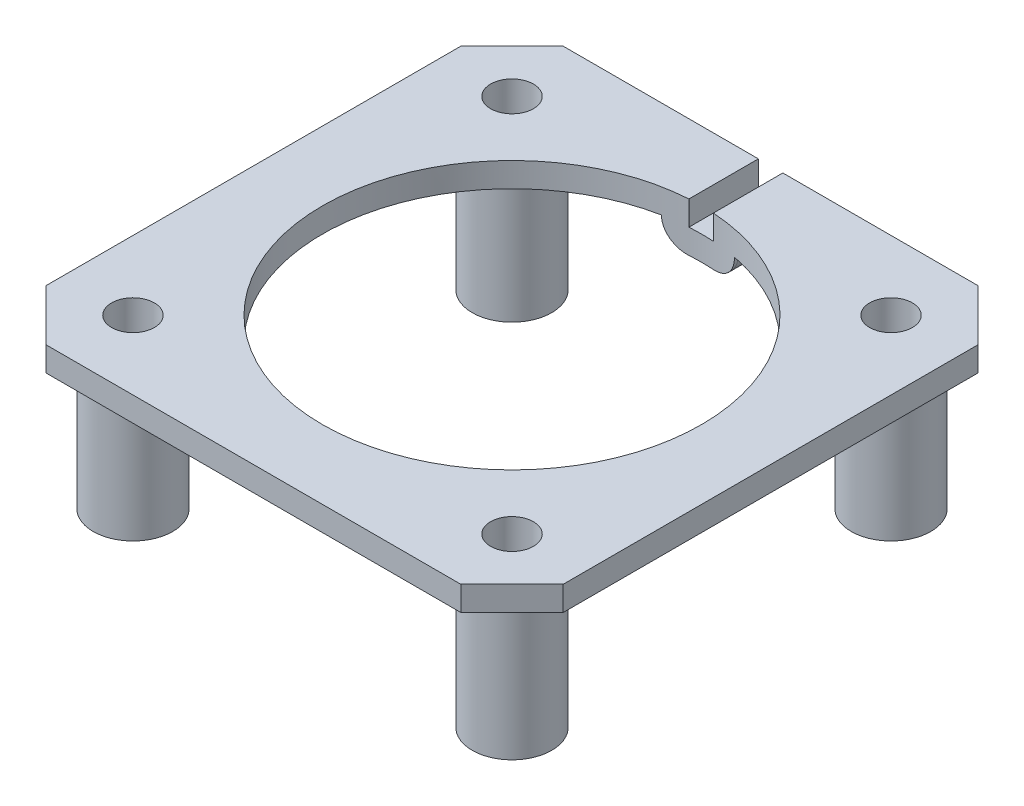
from build123d import *
from build123d.topology import SkipClean

# Parameters (mm, degrees)
SKETCH1_R               = 3.25
BOSS_EXTRUDE1_DEPTH     = 13.7
SKETCH2_W               = 42.3
SKETCH2_H               = 42.3
SKETCH2_R               = 15.5
BOSS_EXTRUDE2_DEPTH     = 2
CUT_EXTRUDE1_DEPTH      = 33.898860163
SKETCH4_R               = 1.75
CUT_EXTRUDE2_DEPTH      = 33.898860163
MIRROR6_COPY_1_SKETCH_R = 1.75
MIRROR6_COPY_1_DEPTH    = 33.898860163
BOSS_EXTRUDE3_DEPTH     = 2
CUT_EXTRUDE3_DEPTH      = 2
FILLET1_R               = 2


with BuildPart() as part:
    # Sketch1 → Boss-Extrude1 (new body)
    with BuildSketch(Plane(origin=(0, 0, 0), x_dir=(1, 0, 0), z_dir=(0, 1, 0))):
        with Locations(Location((-15.5, 15.5, 0), (0, 0, 270))):
            Circle(SKETCH1_R)
    extrude(amount=BOSS_EXTRUDE1_DEPTH)


with BuildPart() as body_2:
    # Mirror2: mirrored copy
    add(part.part.mirror(Plane(origin=(0, 0, 0), x_dir=(0, 0, 1), z_dir=(1, 0, 0))))


with BuildPart() as body_3:
    # Mirror3: mirrored copy
    add(part.part.mirror(Plane.XY))


with BuildPart() as body_4:
    # Mirror3 2: mirrored copy
    add(body_2.part.mirror(Plane.XY))


with BuildPart() as part_1:
    add(part.part)

    add(body_2.part)  # Boss-Extrude2 merges body 2

    add(body_3.part)  # Boss-Extrude2 merges body 3

    add(body_4.part)  # Boss-Extrude2 merges body 4
    # Sketch2 → Boss-Extrude2 (add)
    with BuildSketch(Plane(origin=(0, 13.7, 0), x_dir=(1, 0, 0), z_dir=(0, 1, 0))):
        Rectangle(SKETCH2_W, SKETCH2_H)
        with Locations(Location((0, 0, 0), (0, 0, 270))):
            Circle(SKETCH2_R, mode=Mode.SUBTRACT)
    extrude(amount=-BOSS_EXTRUDE2_DEPTH)

    # Sketch3 → Cut-Extrude1 (cut, through all)
    with BuildSketch(Plane(origin=(0, 13.7, 0), x_dir=(1, 0, 0), z_dir=(0, 1, 0))):
        Polygon((-16.963055506, 21.15), (-21.15, 16.963055506), (-21.15, 21.15), align=None)
        Polygon((16.963055506, -21.15), (21.15, -16.963055506), (21.15, -21.15), align=None)
    cut_extrude1 = extrude(amount=-CUT_EXTRUDE1_DEPTH, mode=Mode.SUBTRACT)

    # Mirror4: Cut-Extrude1 across plane
    add(cut_extrude1.mirror(Plane.XY), mode=Mode.SUBTRACT)

    # Sketch4 → Cut-Extrude2 (cut, through all)
    with BuildSketch(Plane.XZ):
        with Locations(Location((15.5, -15.5, 0), (0, 0, 270))):
            Circle(SKETCH4_R)
    cut_extrude2 = extrude(amount=-CUT_EXTRUDE2_DEPTH, mode=Mode.SUBTRACT)

    # Mirror5: Cut-Extrude2 across plane
    add(cut_extrude2.mirror(Plane(origin=(0, 0, 0), x_dir=(0, 0, 1), z_dir=(1, 0, 0))), mode=Mode.SUBTRACT)

    # Mirror6: Cut-Extrude2 across plane
    add(cut_extrude2.mirror(Plane.XY), mode=Mode.SUBTRACT)

    # Mirror6 copy 1 sketch → Mirror6 copy 1 (cut, through all)
    with BuildSketch(Plane(origin=(0, 0, 0), x_dir=(-1, 0, 0), z_dir=(0, -1, 0))):
        with Locations(Location((15.5, -15.5, 0), (0, 0, 270))):
            Circle(MIRROR6_COPY_1_SKETCH_R)
    extrude(amount=-MIRROR6_COPY_1_DEPTH, mode=Mode.SUBTRACT)

    # Sketch6 → Boss-Extrude3 (add)
    with SkipClean():  # the faces are left unmerged after this step: merging them gives an invalid solid
        with BuildSketch(Plane.XZ.offset(-11.7)):
            with BuildLine():
                Line((-3, -21.15), (-3, -15.5))
                ThreePointArc((-3, -15.5), (-2.996477704, -15.354668076), (-2.985919088, -15.209677419))
                ThreePointArc((-2.985919088, -15.209677419), (0, -15.5), (2.985919088, -15.209677419))
                ThreePointArc((2.985919088, -15.209677419), (2.996477704, -15.354668076), (3, -15.5))
                Line((3, -15.5), (3, -21.15))
                Line((3, -21.15), (-3, -21.15))
            make_face()
        extrude(amount=BOSS_EXTRUDE3_DEPTH)

    # Sketch7 → Cut-Extrude3 (cut)
    with SkipClean():  # the faces are left unmerged after this step: merging them gives an invalid solid
        with BuildSketch(Plane(origin=(0, 13.7, 0), x_dir=(1, 0, 0), z_dir=(0, 1, 0))):
            with BuildLine():
                Line((-1, 15.5), (-1, 21.15))
                ThreePointArc((-1, 21.15), (0, 22.15), (1, 21.15))
                Line((1, 21.15), (1, 15.5))
                ThreePointArc((1, 15.5), (0, 14.5), (-1, 15.5))
            make_face()
        extrude(amount=-CUT_EXTRUDE3_DEPTH, mode=Mode.SUBTRACT)

    # Fillet1
    fillet1_edges = [part_1.edges().sort_by_distance(p)[0] for p in [
        (2.996477704, 9.7, -15.354668076),
        (-2.996477704, 9.7, -15.354668076),
        (3, 9.7, -18.325),
        (-3, 9.7, -18.325),
    ]]
    fillet(fillet1_edges, radius=FILLET1_R - 0.0001)  # a hair under: the kernel refuses the full size


solid = part_1.part
